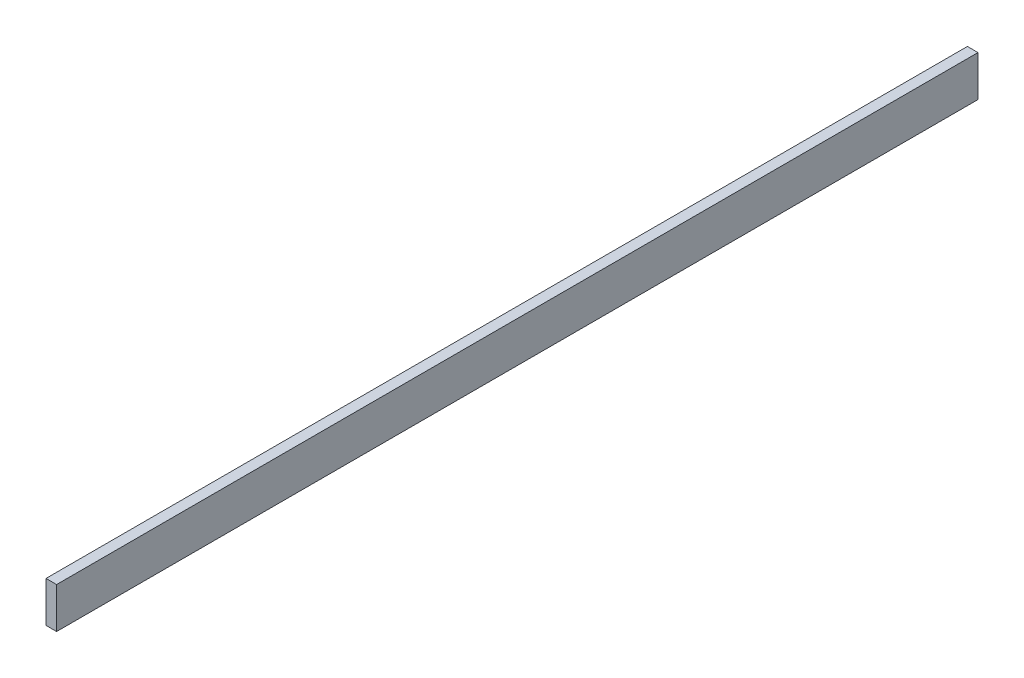
from build123d import *

# Parameters (mm, degrees)
SKETCH_1_W             = 4
SKETCH_1_H             = 348
SM_BASE_FLANGE_1_DEPTH = 15.382715


# Sheet-metal steps are written as plain solids
with BuildPart() as part:
    # Sketch 1 → Базовая кромка1 (new body)
    with BuildSketch(Plane(origin=(0, 0, 0), x_dir=(1, 0, 0), z_dir=(0, 1, 0))):
        with Locations((2, -227)):
            Rectangle(SKETCH_1_W, SKETCH_1_H)
    extrude(amount=-SM_BASE_FLANGE_1_DEPTH)


solid = part.part
